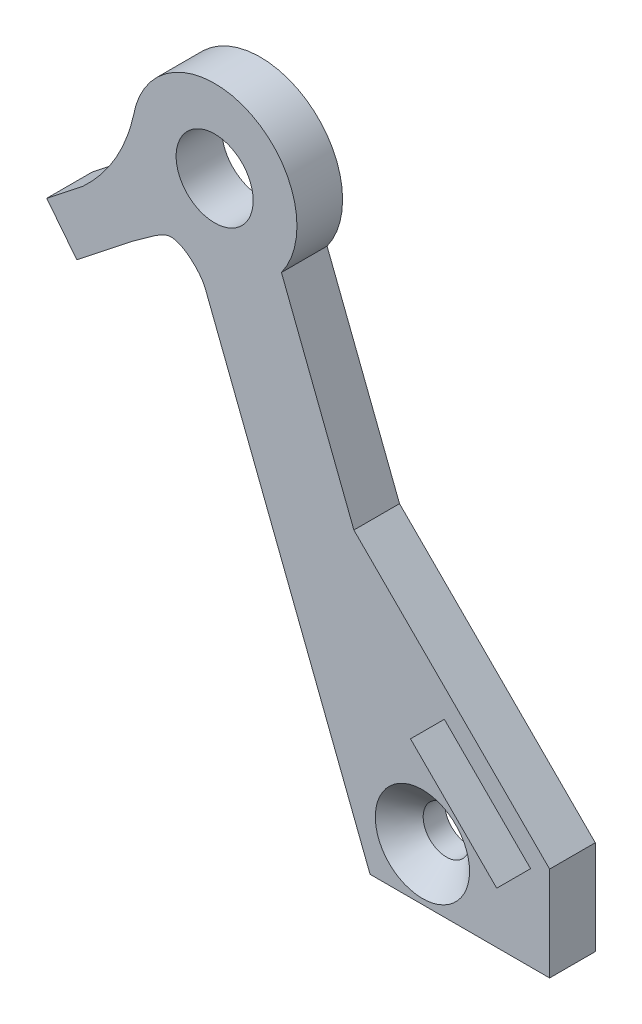
from build123d import *

# Parameters (mm, degrees)
SKETCH1_R           = 1.5
SKETCH1_R_2         = 2.575
BOSS_EXTRUDE1_DEPTH = 3.05


with BuildPart() as part:
    # Sketch1 → Boss-Extrude1 (new body)
    with BuildSketch(Plane.XY):
        with BuildLine():
            Line((-11.023595443, 28.429411507), (0, 0))
            Line((0, 0), (12, 0))
            Line((12, 0), (12, 6.303908615))
            Line((12, 6.303908615), (-1.081475452, 19.385384067))
            Line((-1.081475452, 19.385384067), (-5.922395187, 31.86992234))
            ThreePointArc((-5.922395187, 31.86992234), (-8.23041323, 40.143289296), (-15.795693046, 36.076092549))
            add(Edge.make_bspline(
                [(-19.20587948, 30.211926046), (-16.56203791, 32.655134021), (-15.795693046, 36.076092549)],
                knots=[0, 0, 0, 1, 1, 1], degree=2))
            Line((-19.20587948, 30.211926046), (-21.607800699, 28.322210258))
            Line((-21.607800699, 28.322210258), (-19.598242576, 25.767963568))
            Line((-19.598242576, 25.767963568), (-15.801971201, 28.75468682))
            add(Edge.make_bspline(
                [(-15.801971201, 28.75468682), (-14.250726427, 29.832667849), (-13.686403645, 30.465561569), (-12.80061423, 30.139351338), (-12.710307328, 30.098566895)],
                knots=[0, 0, 0, 0, 0.517103648, 0.574559609, 0.574559609, 0.574559609, 0.574559609], degree=3))
            ThreePointArc((-12.710307328, 30.098566895), (-12.692904865, 30.090489459), (-12.675474331, 30.082472777))
            add(Edge.make_bspline(
                [(-12.675474331, 30.082472777), (-12.015320803, 29.770642777), (-11.273776253, 29.036291886), (-11.023595443, 28.429411507)],
                knots=[0.581929452, 0.581929452, 0.581929452, 0.581929452, 1, 1, 1, 1], degree=3))
        make_face()
        with Locations((3.5, 3.5)):
            Circle(SKETCH1_R, mode=Mode.SUBTRACT)
        Polygon((10.727207794, 5.692209589), (8.517499103, 3.482500897), (8.464466094, 3.429467889), (2.701545827, 9.192388155), (4.964287527, 11.455129855), align=None, mode=Mode.SUBTRACT)
        with Locations((-10.386034879, 35.083319405)):
            Circle(SKETCH1_R_2, mode=Mode.SUBTRACT)
    extrude(amount=BOSS_EXTRUDE1_DEPTH)

    # Sketch3 → CSK for M3 Flat Head Machine Screw1 (revolve, cut)
    with BuildSketch(Plane(origin=(3.5, 3.5, 3.05), x_dir=(0, -1, 0), z_dir=(1, 0, 0))):
        Polygon((0, 0), (0, 3.05), (1.55, 3.05), (1.55, 1.6), (3.15, 0), align=None)
    revolve(axis=Axis((3.5, 3.5, 9.4), (0, 0, -1)), mode=Mode.SUBTRACT)


solid = part.part
